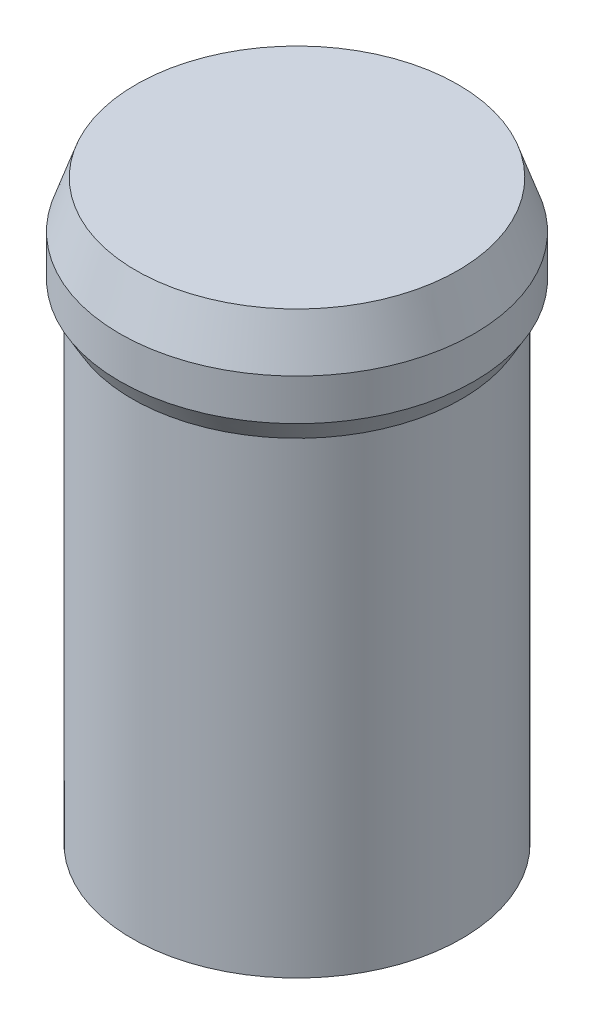
from build123d import *

# Parameters (mm, degrees)
FILLET1_SIZE = 1.5


with BuildPart() as part:
    # Sketch1 → Revolve1 (revolve)
    with BuildSketch(Plane.XY, mode=Mode.PRIVATE) as revolve1_sk:
        Polygon((20, 0), (20, 56.727116956), (21.5, 59.325193167), (21.5, 64.325193167), (19.547262907, 69.998535907), (0, 69.998535907), (0, 2.4), (4.5, 2.4), (4.5, 1.15), (19, 1.15), (19, 0), align=None)
    revolve(revolve1_sk.sketch.rotate(Axis((0, 2.4, 0), (0, 1, 0)), 90), axis=Axis((0, 2.4, 0), (0, 1, 0)))

    # Fillet1
    # the kernel refuses this chamfer: 1.5 mm, written as the material it takes off along each edge
    with BuildSketch(Plane(origin=(0, 1.15, 0), x_dir=(0, 0, -1), z_dir=(1, 0, 0))) as fillet1_piece_1_section:
        Polygon((4.5, FILLET1_SIZE), (4.5 + FILLET1_SIZE, 0), (4.5, 0), align=None)
    fillet1_piece_1 = revolve(axis=Axis((0, 1.15, 0), (0, 1, 0)), mode=Mode.PRIVATE)
    fillet1_piece_1 = split(fillet1_piece_1, bisect_by=Plane(origin=(0, 2.4, 5.37255081), z_dir=(0, -1, 0)), keep=Keep.TOP, mode=Mode.PRIVATE)
    add(fillet1_piece_1, mode=Mode.SUBTRACT)


solid = part.part
